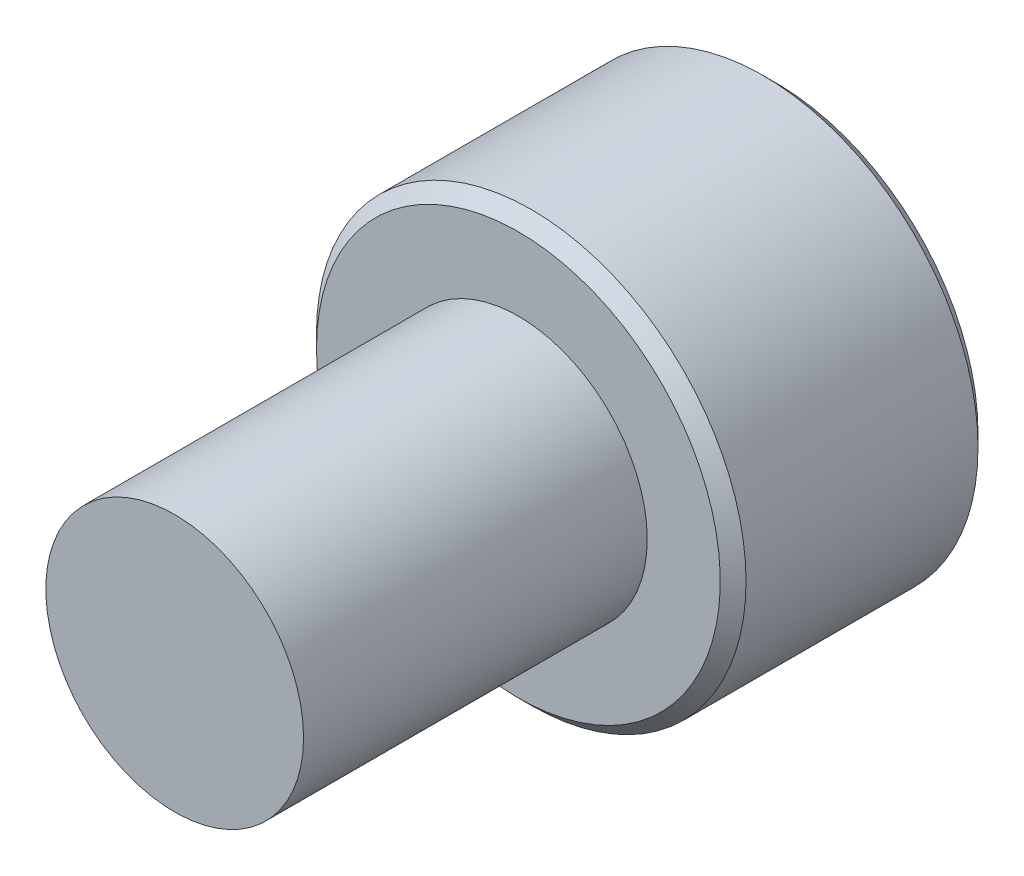
from build123d import *

# Parameters (mm, degrees)
SKETCH1_R          = 3
EXTRUDE1_DEPTH     = 8
SKETCH6_R          = 5
EXTRUDE2_DEPTH     = 6
CUT_EXTRUDE1_DEPTH = 3.75
CHAMFER1_SIZE      = 0.3


with BuildPart() as part:
    # Sketch1 → Extrude1 (new body)
    with BuildSketch(Plane.XY):
        Circle(SKETCH1_R)
    extrude(amount=-EXTRUDE1_DEPTH)

    # Sketch6 → Extrude2 (add)
    with BuildSketch(Plane(origin=(0, 0, -8), x_dir=(-1, 0, 0), z_dir=(0, 0, -1))):
        Circle(SKETCH6_R)
    extrude(amount=EXTRUDE2_DEPTH)

    # Sketch7 → Cut-Extrude1 (cut)
    with BuildSketch(Plane(origin=(0, 0, -14), x_dir=(-1, 0, 0), z_dir=(0, 0, -1))):
        Polygon((0, 2.886751346), (-2.5, 1.443375673), (-2.5, -1.443375673), (0, -2.886751346), (2.5, -1.443375673), (2.5, 1.443375673), align=None)
    extrude(amount=-CUT_EXTRUDE1_DEPTH, mode=Mode.SUBTRACT)

    # Cut-Extrude2 cone 1 section (through the dimple's axis) → Cut-Extrude2 (revolve, cut)
    with BuildSketch(Plane(origin=(0, 0, -14), x_dir=(0, 1, 0), z_dir=(1, 0, 0))):
        Polygon((0, 0), (2.886751346, 0), (0, 2.886751346), align=None)
    revolve(axis=Axis((0, 0, -14), (0, 0, 1)), mode=Mode.SUBTRACT)

    # Chamfer1
    chamfer1_edges = [part.edges().sort_by_distance(p)[0] for p in [
        (5, 0, -14),
        (5, 0, -8),
    ]]
    chamfer(chamfer1_edges, length=CHAMFER1_SIZE)

    # Sketch10 → Revolve1 (revolve)
    with BuildSketch(Plane(origin=(0, 0, 0), x_dir=(0, 0, -1), z_dir=(1, 0, 0))):
        Polygon((8, 3), (8, 0), (6.507359313, 0), (7.75, 3), align=None)
    revolve(axis=Axis((0, 0, -8), (0, 0, 1)))


solid = part.part
